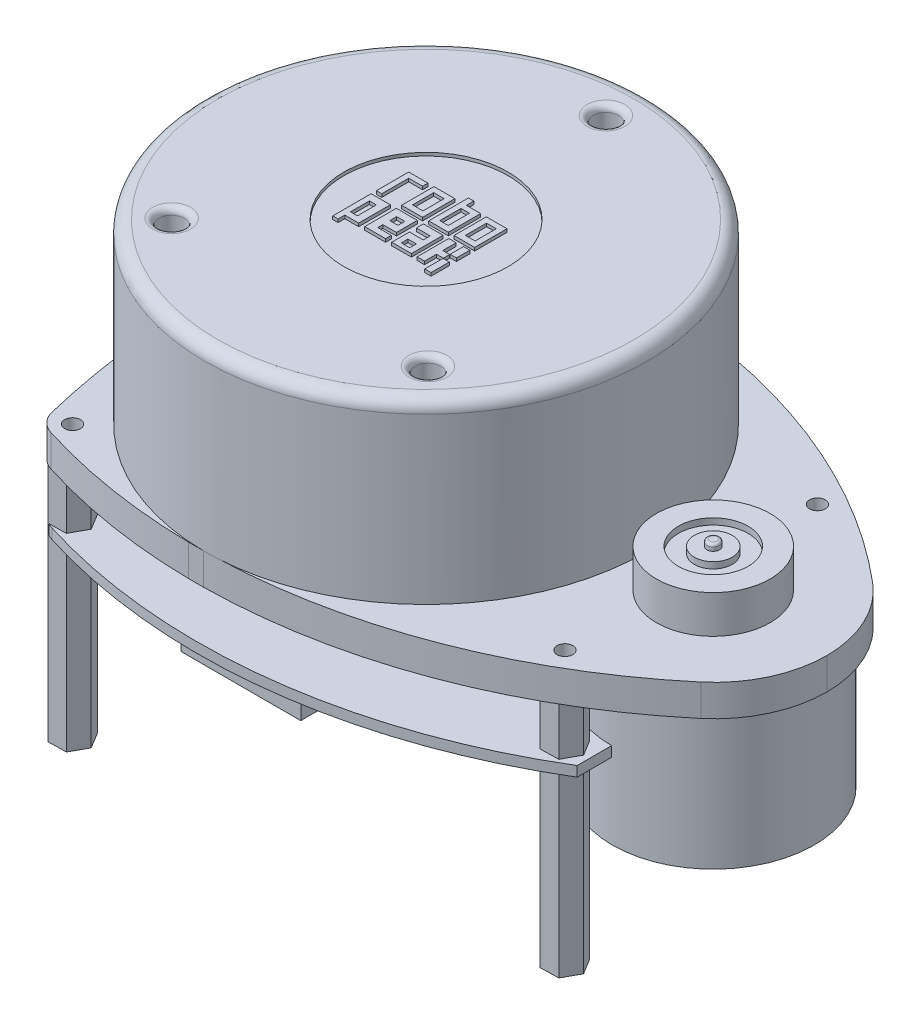
from build123d import *

# Parameters (mm, degrees)
SKETCH_1_W          = 98.5
SKETCH_1_H          = 70
EXTRUDE_1_DEPTH     = 5
SKETCH_2_R          = 35
EXTRUDE_2_DEPTH     = 28.1
SKETCH_3_R          = 2
CUT_EXTRUDE_1_DEPTH = 5
FILLET_1_R          = 2
FILLET_2_R          = 1
SKETCH_4_R          = 13
SKETCH_4_W          = 3.316540618
SKETCH_4_H          = 5.120069114
SKETCH_4_W_2        = 3.276095001
SKETCH_4_W_3        = 1.001370982
SKETCH_4_H_2        = 2.121481923
SKETCH_4_H_3        = 2.893302243
SKETCH_4_W_4        = 1.096399653
SKETCH_4_H_4        = 2.99297568
SKETCH_4_W_5        = 1.536933457
SKETCH_4_H_5        = 3.356986235
SKETCH_4_W_6        = 1.658270309
SKETCH_4_W_7        = 1.334705371
SKETCH_4_H_6        = 1.05158605
SKETCH_4_W_8        = 1.294259754
SKETCH_4_H_7        = 1.092031667
CUT_EXTRUDE_3_DEPTH = 0.5
SKETCH_5_R          = 1.25
CUT_EXTRUDE_4_DEPTH = 5
SKETCH_6_R          = 9
EXTRUDE_3_DEPTH     = 7
CUT_EXTRUDE_START   = -1
SKETCH_7_R          = 9
SKETCH_7_R_2        = 0.99350654
CUT_EXTRUDE_5_DEPTH = 1
SKETCH_8_R          = 5.521677929
SKETCH_8_R_2        = 3.001097475
CUT_EXTRUDE_6_DEPTH = 1
FILLET_3_R          = 0.4
SKETCH_9_R          = 16
EXTRUDE_4_DEPTH     = 27
EXTRUDE_5_DEPTH     = 38
SKETCH_11_R         = 26
EXTRUDE_6_DEPTH     = 8
FILLET_4_R          = 1
SKETCH_12_W         = 106.251501727
SKETCH_12_H         = 75.565901032
CUT_EXTRUDE_7_DEPTH = 8
FILLET_5_R          = 100
EXTRUDE_START       = 8
EXTRUDE_7_DEPTH     = 1.6
SKETCH_14_W         = 20
SKETCH_14_H         = 5
EXTRUDE_8_DEPTH     = 6
CHAMFER_1_SIZE      = 1


with BuildPart() as part:
    # Эскиз1 → Бобышка-Вытянуть1 (new body)
    with BuildSketch(Plane(origin=(0, 0, 0), x_dir=(1, 0, 0), z_dir=(0, 1, 0))):
        Rectangle(SKETCH_1_W, SKETCH_1_H)
    extrude(amount=EXTRUDE_1_DEPTH)

    # Эскиз2 → Бобышка-Вытянуть2 (add)
    with BuildSketch(Plane(origin=(0, 5, 0), x_dir=(1, 0, 0), z_dir=(0, 1, 0))):
        with Locations(Location((-14.25, 0, 0), (0, 0, 270))):
            Circle(SKETCH_2_R)
    extrude(amount=EXTRUDE_2_DEPTH)

    # Эскиз3 → Вырез-Вытянуть1 (cut)
    with BuildSketch(Plane(origin=(0, 33.1, 0), x_dir=(1, 0, 0), z_dir=(0, 1, 0))):
        with Locations(Location((-14.25, 28.5, 0), (0, 0, 270))):
            Circle(SKETCH_3_R)
        with Locations(Location((-34.553940504, -20, 0), (0, 0, 270))):
            Circle(SKETCH_3_R)
        with Locations(Location((6.053940504, -20, 0), (0, 0, 270))):
            Circle(SKETCH_3_R)
    extrude(amount=-CUT_EXTRUDE_1_DEPTH, mode=Mode.SUBTRACT)

    # Скругление1
    fillet_1_edges = [part.edges().sort_by_distance(p)[0] for p in [
        (-14.25, 33.1, -35),
    ]]
    fillet(fillet_1_edges, radius=FILLET_1_R)

    # Скругление2
    fillet_2_edges = [part.edges().sort_by_distance(p)[0] for p in [
        (-14.25, 33.1, -30.5),
        (-34.553940504, 33.1, 18),
        (6.053940504, 33.1, 18),
    ]]
    fillet(fillet_2_edges, radius=FILLET_2_R)

    # Эскиз4 → Вырез-Вытянуть3 (cut)
    # profile 1 of 7: a face of its own
    with BuildSketch(Plane(origin=(0, 33.1, 0), x_dir=(1, 0, 0), z_dir=(0, 1, 0))):
        with Locations(Location((-14.25, 0, 0), (0, 0, 270))):
            Circle(SKETCH_4_R)
        Polygon((-22.115166942, -6.914876839), (-22.115166942, -0.831627154), (-19.0735421, -0.831627154), (-19.0735421, -5.853844917), (-21.266341405, -5.853844917), (-21.266341405, -6.914876839), align=None, mode=Mode.SUBTRACT)
        Polygon((-22.115166942, 0), (-22.115166942, 5.120069114), (-19.0735421, 5.120069114), (-19.0735421, 4.27071115), (-21.266341405, 4.27071115), (-21.266341405, 0), align=None, mode=Mode.SUBTRACT)
        Polygon((-13.829606569, 0), (-13.829606569, 6.292992015), (-12.980248606, 6.292992015), (-12.980248606, 5.120069114), (-10.715294037, 5.120069114), (-10.715294037, 0), align=None, mode=Mode.SUBTRACT)
        with Locations((-16.458571693, 2.560034557)):
            Rectangle(SKETCH_4_W, SKETCH_4_H, mode=Mode.SUBTRACT)
        with Locations((-8.187442955, 2.560034557)):
            Rectangle(SKETCH_4_W_2, SKETCH_4_H, mode=Mode.SUBTRACT)
        with Locations((-7.050080946, -1.825090787)):
            Rectangle(SKETCH_4_W_3, SKETCH_4_H_2, mode=Mode.SUBTRACT)
        with Locations((-7.050080946, -5.468225718)):
            Rectangle(SKETCH_4_W_3, SKETCH_4_H_3, mode=Mode.SUBTRACT)
        Polygon((-9.825490456, -0.831627154), (-8.643651064, -0.831627154), (-8.643651064, -2.960833634), (-7.550766437, -2.960833634), (-7.550766437, -3.957287265), (-8.643651064, -3.957287265), (-8.643651064, -5.853844917), (-9.825490456, -5.853844917), align=None, mode=Mode.SUBTRACT)
        Polygon((-13.829606569, -0.831627154), (-10.715294037, -0.831627154), (-10.715294037, -5.853844917), (-13.829606569, -5.853844917), (-13.829606569, -3.04994558), (-11.645543235, -3.04994558), (-11.645543235, -1.940786367), (-13.829606569, -1.940786367), align=None, mode=Mode.SUBTRACT)
        Polygon((-18.116842002, -0.831627154), (-14.800301384, -0.831627154), (-14.800301384, -4.141977247), (-16.943919101, -4.141977247), (-16.943919101, -4.950889593), (-14.800301384, -4.950889593), (-14.800301384, -5.853844917), (-18.116842002, -5.853844917), align=None, mode=Mode.SUBTRACT)
    # profile 2 of 7: a face of its own
    with BuildSketch(Plane(origin=(0, 33.1, 0), x_dir=(1, 0, 0), z_dir=(0, 1, 0))):
        with Locations((-20.718141579, -3.454401753)):
            Rectangle(SKETCH_4_W_4, SKETCH_4_H_4)
    # profile 3 of 7: a face of its own
    with BuildSketch(Plane(origin=(0, 33.1, 0), x_dir=(1, 0, 0), z_dir=(0, 1, 0))):
        with Locations((-8.167220148, 2.592218033)):
            Rectangle(SKETCH_4_W_5, SKETCH_4_H_5)
    # profile 4 of 7: a face of its own
    with BuildSketch(Plane(origin=(0, 33.1, 0), x_dir=(1, 0, 0), z_dir=(0, 1, 0))):
        with Locations((-16.478794502, 2.592218033)):
            Rectangle(SKETCH_4_W_6, SKETCH_4_H_5)
    # profile 5 of 7: a face of its own
    with BuildSketch(Plane(origin=(0, 33.1, 0), x_dir=(1, 0, 0), z_dir=(0, 1, 0))):
        with Locations((-12.312895921, 2.592218033)):
            Rectangle(SKETCH_4_W_7, SKETCH_4_H_5)
    # profile 6 of 7: a face of its own
    with BuildSketch(Plane(origin=(0, 33.1, 0), x_dir=(1, 0, 0), z_dir=(0, 1, 0))):
        with Locations((-12.312895921, -4.667770272)):
            Rectangle(SKETCH_4_W_7, SKETCH_4_H_6)
    # profile 7 of 7: a face of its own
    with BuildSketch(Plane(origin=(0, 33.1, 0), x_dir=(1, 0, 0), z_dir=(0, 1, 0))):
        with Locations((-16.296789224, -2.503929746)):
            Rectangle(SKETCH_4_W_8, SKETCH_4_H_7)
    extrude(amount=-CUT_EXTRUDE_3_DEPTH, mode=Mode.SUBTRACT)

    # Эскиз5 → Вырез-Вытянуть4 (cut)
    with BuildSketch(Plane(origin=(0, 5, 0), x_dir=(1, 0, 0), z_dir=(0, 1, 0))):
        with Locations(Location((-42.25, 28, 0), (0, 0, 270))):
            Circle(SKETCH_5_R)
        with Locations(Location((27.75, 20, 0), (0, 0, 270))):
            Circle(SKETCH_5_R)
        with Locations(Location((27.75, -20, 0), (0, 0, 90))):
            Circle(SKETCH_5_R)
        with Locations(Location((-42.25, -28, 0), (0, 0, 90))):
            Circle(SKETCH_5_R)
    extrude(amount=-CUT_EXTRUDE_4_DEPTH, mode=Mode.SUBTRACT)

    # Эскиз6 → Бобышка-Вытянуть3 (add)
    with BuildSketch(Plane(origin=(0, 5, 0), x_dir=(1, 0, 0), z_dir=(0, 1, 0))):
        with Locations(Location((31.25, 0, 0), (0, 0, 270))):
            Circle(SKETCH_6_R)
    extrude(amount=EXTRUDE_3_DEPTH)

    # Эскиз7 → Вырез-Вытянуть5 (cut)
    with BuildSketch(Plane(origin=(0, 12, 0), x_dir=(1, 0, 0), z_dir=(0, 1, 0)).offset(CUT_EXTRUDE_START)):
        with Locations(Location((31.25, 0, 0), (0, 0, 270))):
            Circle(SKETCH_7_R)
        with Locations(Location((31.25, 0, 0), (0, 0, 270))):
            Circle(SKETCH_7_R_2, mode=Mode.SUBTRACT)
    extrude(amount=CUT_EXTRUDE_5_DEPTH, mode=Mode.SUBTRACT)

    # Эскиз8 → Вырез-Вытянуть6 (cut)
    with BuildSketch(Plane(origin=(0, 11, 0), x_dir=(1, 0, 0), z_dir=(0, 1, 0))):
        with Locations(Location((31.25, 0, 0), (0, 0, 270))):
            Circle(SKETCH_8_R)
        with Locations(Location((31.25, 0, 0), (0, 0, 270))):
            Circle(SKETCH_8_R_2, mode=Mode.SUBTRACT)
    extrude(amount=-CUT_EXTRUDE_6_DEPTH, mode=Mode.SUBTRACT)

    # Скругление3
    fillet_3_edges = [part.edges().sort_by_distance(p)[0] for p in [
        (31.25, 12, -0.99350654),
    ]]
    fillet(fillet_3_edges, radius=FILLET_3_R)

    # Эскиз9 → Бобышка-Вытянуть4 (add)
    with BuildSketch(Plane(origin=(0, 5, 0), x_dir=(1, 0, 0), z_dir=(0, 1, 0))):
        with Locations(Location((31.25, 0, 0), (0, 0, 270))):
            Circle(SKETCH_9_R)
    extrude(amount=-EXTRUDE_4_DEPTH)

    # Эскиз10 → Бобышка-Вытянуть5 (add)
    with BuildSketch(Plane.XZ):
        Polygon((-40.854614908, 25.472900125), (-39.363774764, 27.944889), (-40.759159856, 30.471988875), (-43.645385092, 30.527099875), (-45.136225236, 28.055111), (-43.740840144, 25.528011125), align=None)
        Polygon((29.257133708, 22.462088812), (26.371335397, 22.536260484), (24.864201688, 20.074171672), (26.242866292, 17.537911188), (29.128664603, 17.463739516), (30.635798312, 19.925828328), align=None)
        Polygon((30.635798312, -19.925828328), (29.257133708, -22.462088812), (26.371335397, -22.536260484), (24.864201688, -20.074171672), (26.242866292, -17.537911188), (29.128664603, -17.463739516), align=None)
        Polygon((-43.740840144, -25.528011125), (-40.854614908, -25.472900125), (-39.363774764, -27.944889), (-40.759159856, -30.471988875), (-43.645385092, -30.527099875), (-45.136225236, -28.055111), align=None)
    extrude(amount=EXTRUDE_5_DEPTH)

    # Эскиз11 → Бобышка-Вытянуть6 (add)
    with BuildSketch(Plane(origin=(0, 5, 0), x_dir=(1, 0, 0), z_dir=(0, 1, 0))):
        with Locations(Location((-14.25, 0, 0), (0, 0, 270))):
            Circle(SKETCH_11_R)
    extrude(amount=-EXTRUDE_6_DEPTH)

    # Скругление4
    fillet_4_edges = [part.edges().sort_by_distance(p)[0] for p in [
        (-14.25, -3, -26),
    ]]
    fillet(fillet_4_edges, radius=FILLET_4_R)

    # Эскиз12 → Вырез-Вытянуть7 (cut)
    with BuildSketch(Plane(origin=(0, 5, 0), x_dir=(1, 0, 0), z_dir=(0, 1, 0))):
        with Locations((-0.925367694, -0.052186396)):
            Rectangle(SKETCH_12_W, SKETCH_12_H)
        with BuildLine():
            ThreePointArc((-49.25, 0), (-48.116981176, 14.083966884), (-45.528607092, 27.974329531))
            ThreePointArc((-45.528607092, 27.974329531), (-44.561596332, 29.769996926), (-42.834972324, 30.855492545))
            ThreePointArc((-42.834972324, 30.855492545), (2.249574036, 33.221442581), (42.908955543, 13.599293477))
            ThreePointArc((42.908955543, 13.599293477), (47.577997957, 7.498372972), (49.25, 0))
            ThreePointArc((49.25, 0), (47.577997957, -7.498372972), (42.908955543, -13.599293477))
            ThreePointArc((42.908955543, -13.599293477), (2.249574036, -33.221442581), (-42.834972324, -30.855492545))
            ThreePointArc((-42.834972324, -30.855492545), (-44.561596332, -29.769996926), (-45.528607092, -27.974329531))
            ThreePointArc((-45.528607092, -27.974329531), (-48.116981176, -14.083966884), (-49.25, 0))
        make_face(mode=Mode.SUBTRACT)
    extrude(amount=-CUT_EXTRUDE_7_DEPTH, mode=Mode.SUBTRACT)

    # Скругление5
    # the kernel refuses this fillet: 100 mm, written as the material it takes off along each edge
    with BuildSketch(Plane(origin=(-49.25, 5, 0), x_dir=(0.06766370453174418, 0, 0.9977081853372963), z_dir=(0, -1, 0))) as fillet_5_piece_1:
        with BuildLine():
            CenterArc((6.776645039, -99.922318338), FILLET_5_R, 87.741474483, 12.276669201)
            ThreePointArc((-10.619357471, -1.44704684), (-5.323940761, -0.618859533), (0, 0))
            ThreePointArc((0, 0), (5.358747467, 0.105631125), (10.717494933, 0))
        make_face()
    extrude(amount=31.793737334, mode=Mode.SUBTRACT)

    # Эскиз13 → Бобышка-Вытянуть7 (add)
    with BuildSketch(Plane.XZ.offset(EXTRUDE_START)):
        with BuildLine():
            Line((31.553634402, 21.860321538), (31.553634402, 16.4))
            ThreePointArc((31.553634402, 16.4), (15.153634402, 0), (31.553634402, -16.4))
            Line((31.553634402, -16.4), (31.553634402, -21.860321538))
            ThreePointArc((31.553634402, -21.860321538), (-4.596615235, -34.347840749), (-42.683124513, -30.855492545))
            ThreePointArc((-42.683124513, -30.855492545), (-44.409748521, -29.769996926), (-45.37675928, -27.974329531))
            ThreePointArc((-45.37675928, -27.974329531), (-47.965133365, -14.083966884), (-49.098152188, 0))
            ThreePointArc((-49.098152188, 0), (-47.965133365, 14.083966884), (-45.37675928, 27.974329531))
            ThreePointArc((-45.37675928, 27.974329531), (-44.409748521, 29.769996926), (-42.683124513, 30.855492545))
            ThreePointArc((-42.683124513, 30.855492545), (-4.596615235, 34.347840749), (31.553634402, 21.860321538))
        make_face()
    extrude(amount=EXTRUDE_7_DEPTH)

    # Эскиз14 → Бобышка-Вытянуть8 (add)
    with BuildSketch(Plane.XZ.offset(9.6)):
        with Locations((-14.098152188, 27.5)):
            Rectangle(SKETCH_14_W, SKETCH_14_H)
    extrude(amount=EXTRUDE_8_DEPTH)

    # Фаска1
    chamfer_1_edges = [part.edges().sort_by_distance(p)[0] for p in [
        (-24.098152188, -12.6, 30),
    ]]
    chamfer(chamfer_1_edges, length=CHAMFER_1_SIZE)


solid = part.part
